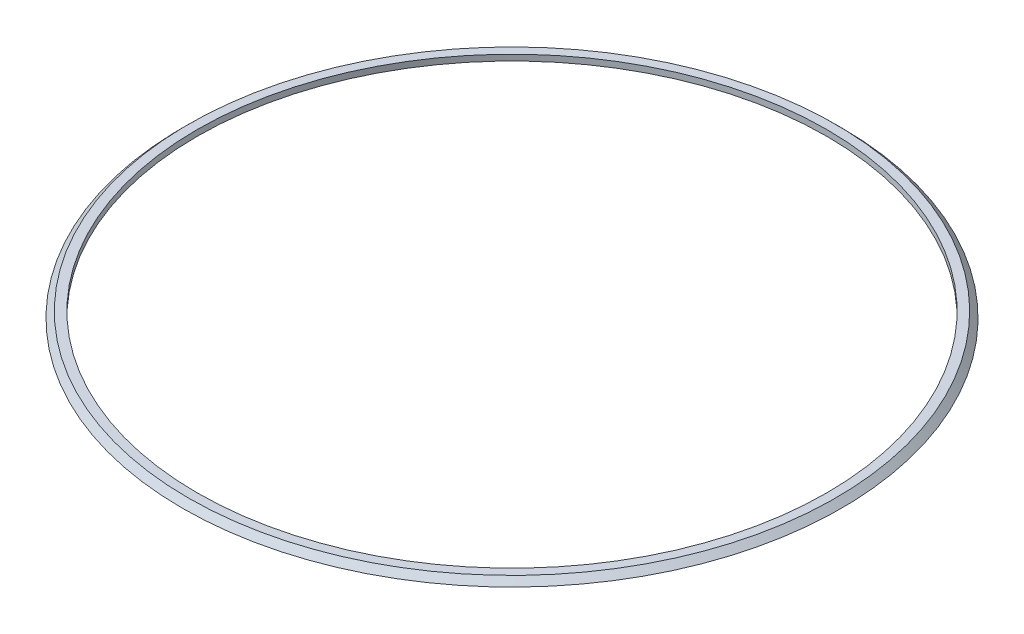
from build123d import *

# Parameters (mm, degrees)
SKETCH1_R           = 44.5
SKETCH1_R_2         = 42.5
BOSS_EXTRUDE1_DEPTH = 0.8
CHAMFER1_SIZE       = 0.8


with BuildPart() as part:
    # Sketch1 → Boss-Extrude1 (new body)
    with BuildSketch(Plane(origin=(0, 0, 0), x_dir=(1, 0, 0), z_dir=(0, 1, 0))):
        with Locations(Location((0, 0, 0), (0, 0, 270))):
            Circle(SKETCH1_R)
        with Locations(Location((0, 0, 0), (0, 0, 270))):
            Circle(SKETCH1_R_2, mode=Mode.SUBTRACT)
    extrude(amount=BOSS_EXTRUDE1_DEPTH)

    # Chamfer1
    chamfer1_edges = [part.edges().sort_by_distance(p)[0] for p in [
        (0, 0.8, -44.5),
    ]]
    chamfer(chamfer1_edges, length=CHAMFER1_SIZE - 0.0001)  # a hair under: the kernel refuses the full size


solid = part.part
